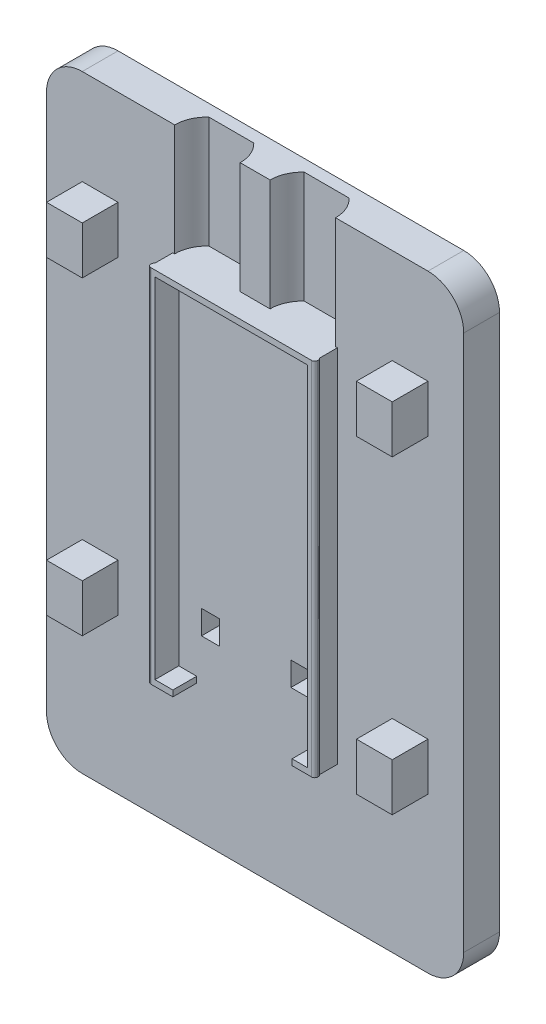
from build123d import *

# Parameters (mm, degrees)
SKETCH1_W            = 15
SKETCH1_H            = 36
BOSS_EXTRUDE1_DEPTH  = 2
SKETCH2_W            = 13.8
SKETCH2_H            = 33.26
SKETCH2_W_2          = 12.8
SKETCH2_H_2          = 32.26
BOSS_EXTRUDE2_DEPTH  = 2
SKETCH3_W            = 0.5
SKETCH3_H            = 33.26
BOSS_EXTRUDE3_DEPTH  = 0.1
FILLET1_R            = 0.25
SKETCH4_W            = 0.5
SKETCH4_H            = 33.26
BOSS_EXTRUDE4_DEPTH  = 0.1
FILLET2_R            = 0.25
CUT_EXTRUDE1_DEPTH   = 3
BOSS_EXTRUDE5_REACH  = 40.797
SKETCH6_W            = 2
SKETCH6_H            = 0.5
SKETCH7_W            = 6
SKETCH7_H            = 0.5
CUT_EXTRUDE2_DEPTH   = 0.5
SKETCH8_W            = 6
SKETCH8_H            = 0.5
CUT_EXTRUDE3_DEPTH   = 1
CUT_EXTRUDE5_DEPTH   = 4.37
SKETCH12_W           = 15
SKETCH12_H           = 36
BOSS_EXTRUDE7_DEPTH  = 1
SKETCH13_W           = 1.5
SKETCH13_H           = 2
CUT_EXTRUDE6_DEPTH   = 40.319206503
SKETCH14_W           = 3
SKETCH14_H           = 36
BOSS_EXTRUDE8_DEPTH  = 10
SKETCH15_W           = 3
SKETCH15_H           = 36
BOSS_EXTRUDE9_DEPTH  = 10
SKETCH17_W           = 2
SKETCH17_H           = 2
CUT_EXTRUDE7_DEPTH   = 10
SKETCH19_W           = 0.569871795
SKETCH19_H           = 3.175
CUT_EXTRUDE8_DEPTH   = 2
SKETCH20_W           = 0.569871794
SKETCH20_H           = 3.175
CUT_EXTRUDE9_DEPTH   = 2
SKETCH21_W           = 0.569871795
SKETCH21_H           = 3.175
CUT_EXTRUDE10_DEPTH  = 2
SKETCH22_W           = 3
SKETCH22_H           = 4
BOSS_EXTRUDE10_DEPTH = 3
BOSS_EXTRUDE11_START = 5
BOSS_EXTRUDE11_DEPTH = 5
FILLET3_R            = 3
SKETCH24_W           = 35
SKETCH24_H           = 3
BOSS_EXTRUDE12_DEPTH = 10
FILLET4_R            = 3


with BuildPart() as part:
    # Sketch1 → Boss-Extrude1 (new body)
    with BuildSketch(Plane.XY):
        with Locations((-7.5, 18)):
            Rectangle(SKETCH1_W, SKETCH1_H)
    extrude(amount=BOSS_EXTRUDE1_DEPTH)

    # Sketch2 → Boss-Extrude2 (add)
    with BuildSketch(Plane.XY.offset(2)):
        with Locations((-7.5, 18)):
            Rectangle(SKETCH2_W, SKETCH2_H)
        with Locations((-7.5, 18)):
            Rectangle(SKETCH2_W_2, SKETCH2_H_2, mode=Mode.SUBTRACT)
    extrude(amount=BOSS_EXTRUDE2_DEPTH)

    # Sketch3 → Boss-Extrude3 (add)
    with BuildSketch(Plane.ZY.offset(14.4)):
        with Locations((3.75, 18)):
            Rectangle(SKETCH3_W, SKETCH3_H)
    extrude(amount=BOSS_EXTRUDE3_DEPTH)

    # Fillet1
    # the kernel refuses this fillet: 0.25 mm, written as the material it takes off along each edge
    with BuildSketch(Plane(origin=(-14.5, 35.255, 4), x_dir=(1, 0, 0), z_dir=(0, -1, 0))) as fillet1_piece_1:
        with BuildLine():
            CenterArc((FILLET1_R, -FILLET1_R), FILLET1_R, 90, 90)
            Line((0, -FILLET1_R), (-FILLET1_R * 0.02, -FILLET1_R))
            Line((-FILLET1_R * 0.02, -FILLET1_R), (-FILLET1_R * 0.02, FILLET1_R * 0.02))
            Line((-FILLET1_R * 0.02, FILLET1_R * 0.02), (FILLET1_R, FILLET1_R * 0.02))
            Line((FILLET1_R, FILLET1_R * 0.02), (FILLET1_R, 0))
        make_face()
    extrude(amount=34.51, mode=Mode.SUBTRACT)
    with BuildSketch(Plane(origin=(-14.5, 0.87, 3.5), x_dir=(0, 0, 1), z_dir=(0, 1, 0))) as fillet1_piece_2:
        with BuildLine():
            CenterArc((0.2, 0.25), FILLET1_R, 216.869897645, 53.130102355)
            Line((0, 0.1), (-0.004, 0.097))
            ThreePointArc((-0.004, 0.097), (-0.005, 0.05), (-0.005, 0))
            Line((-0.005, 0), (0, -0.005))
            Line((0, -0.005), (0.2, -0.005))
            Line((0.2, -0.005), (0.2, 0))
        make_face()
    extrude(amount=34.26, mode=Mode.SUBTRACT)

    # Sketch4 → Boss-Extrude4 (add)
    with BuildSketch(Plane(origin=(-0.6, 0, 0), x_dir=(0, 0, -1), z_dir=(1, 0, 0))):
        with Locations((-3.75, 18)):
            Rectangle(SKETCH4_W, SKETCH4_H)
    extrude(amount=BOSS_EXTRUDE4_DEPTH)

    # Fillet2
    # the kernel refuses this fillet: 0.25 mm, written as the material it takes off along each edge
    with BuildSketch(Plane(origin=(-0.5, 35.255, 4), x_dir=(0, 0, -1), z_dir=(0, -1, 0))) as fillet2_piece_1:
        with BuildLine():
            CenterArc((FILLET2_R, -FILLET2_R), FILLET2_R, 90, 90)
            Line((0, -FILLET2_R), (-FILLET2_R * 0.02, -FILLET2_R))
            Line((-FILLET2_R * 0.02, -FILLET2_R), (-FILLET2_R * 0.02, FILLET2_R * 0.02))
            Line((-FILLET2_R * 0.02, FILLET2_R * 0.02), (FILLET2_R, FILLET2_R * 0.02))
            Line((FILLET2_R, FILLET2_R * 0.02), (FILLET2_R, 0))
        make_face()
    extrude(amount=34.51, mode=Mode.SUBTRACT)
    with BuildSketch(Plane(origin=(-0.5, 0.87, 3.5), x_dir=(-1.0, 0, 2.6085800186082363e-11), z_dir=(0, 1, 0))) as fillet2_piece_2:
        with BuildLine():
            CenterArc((0.25, 0.2), FILLET2_R, 179.999999999, 53.130102355)
            Line((0, 0.2), (-0.005, 0.2))
            Line((-0.005, 0.2), (-0.005, 0))
            Line((-0.005, 0), (0, -0.005))
            ThreePointArc((0, -0.005), (0.05, -0.005), (0.097, -0.004))
            Line((0.097, -0.004), (0.1, 0))
        make_face()
    extrude(amount=34.26, mode=Mode.SUBTRACT)

    # Sketch5 → Cut-Extrude1 (cut)
    with BuildSketch(Plane(origin=(0, 34.63, 0), x_dir=(1, 0, 0), z_dir=(0, 1, 0))):
        with BuildLine():
            Line((-14.25, -4), (-0.75, -4))
            ThreePointArc((-0.75, -4), (-0.573223305, -3.926776695), (-0.5, -3.75))
            Line((-0.5, -3.75), (-0.5, -3.7))
            ThreePointArc((-0.5, -3.7), (-0.526393202, -3.588196601), (-0.6, -3.5))
            Line((-0.6, -3.5), (-0.6, -2))
            Line((-0.6, -2), (-14.4, -2))
            Line((-14.4, -2), (-14.4, -3.5))
            ThreePointArc((-14.4, -3.5), (-14.473606798, -3.588196601), (-14.5, -3.7))
            Line((-14.5, -3.7), (-14.5, -3.75))
            ThreePointArc((-14.5, -3.75), (-14.426776695, -3.926776695), (-14.25, -4))
        make_face()
    extrude(amount=-CUT_EXTRUDE1_DEPTH, mode=Mode.SUBTRACT)

    # Sketch6 → Boss-Extrude5 (add, up to next)
    with BuildSketch(Plane.ZY.offset(1.1), mode=Mode.PRIVATE) as boss_extrude5_sk1:
        with Locations((3, 31.38)):
            Rectangle(SKETCH6_W, SKETCH6_H)
    boss_extrude5_tool1 = extrude(boss_extrude5_sk1.sketch, amount=BOSS_EXTRUDE5_REACH, mode=Mode.PRIVATE) - part.part
    add(boss_extrude5_tool1.solids().sort_by_distance((-1.1, 31.38, 3))[0])

    # Sketch7 → Cut-Extrude2 (cut)
    with BuildSketch(Plane.XZ.offset(-1.37)):
        with Locations((-7.4, 3.75)):
            Rectangle(SKETCH7_W, SKETCH7_H)
        with Locations((-7.4, 3.25)):
            Rectangle(SKETCH7_W, SKETCH7_H)
    extrude(amount=-CUT_EXTRUDE2_DEPTH, mode=Mode.SUBTRACT)

    # Sketch8 → Cut-Extrude3 (cut)
    with BuildSketch(Plane.XY.offset(3)):
        with Locations((-7.4, 1.62)):
            Rectangle(SKETCH8_W, SKETCH8_H)
    extrude(amount=-CUT_EXTRUDE3_DEPTH, mode=Mode.SUBTRACT)

    # Sketch10 → Cut-Extrude5 (cut)
    with BuildSketch(Plane(origin=(0, 36, 0), x_dir=(1, 0, 0), z_dir=(0, 1, 0))):
        with BuildLine():
            ThreePointArc((-8.75, -2), (-8.974825632, -0.910966294), (-9.612541391, 0))
            Line((-9.612541391, 0), (-13.387458609, 0))
            ThreePointArc((-13.387458609, 0), (-14.025174368, -0.910966294), (-14.25, -2))
            Line((-14.25, -2), (-8.75, -2))
        make_face()
        with BuildLine():
            ThreePointArc((-14.25, -2), (-11.5, -4.75), (-8.75, -2))
            Line((-8.75, -2), (-14.25, -2))
        make_face()
        with BuildLine():
            ThreePointArc((-0.75, -2), (-0.974825632, -0.910966294), (-1.612541391, 0))
            Line((-1.612541391, 0), (-5.387458609, 0))
            ThreePointArc((-5.387458609, 0), (-6.025174368, -0.910966294), (-6.25, -2))
            Line((-6.25, -2), (-0.75, -2))
        make_face()
        with BuildLine():
            ThreePointArc((-6.25, -2), (-3.5, -4.75), (-0.75, -2))
            Line((-0.75, -2), (-6.25, -2))
        make_face()
    extrude(amount=-CUT_EXTRUDE5_DEPTH, mode=Mode.SUBTRACT)

    # Sketch12 → Boss-Extrude7 (add)
    with BuildSketch(Plane(origin=(0, 0, 0), x_dir=(-1, 0, 0), z_dir=(0, 0, -1))):
        with Locations((7.5, 18)):
            Rectangle(SKETCH12_W, SKETCH12_H)
    extrude(amount=BOSS_EXTRUDE7_DEPTH)

    # Sketch13 → Cut-Extrude6 (cut, through all)
    with BuildSketch(Plane(origin=(0, 0, -1), x_dir=(-1, 0, 0), z_dir=(0, 0, -1))):
        with Locations((3.75, 6)):
            Rectangle(SKETCH13_W, SKETCH13_H)
        with Locations((11.25, 6)):
            Rectangle(SKETCH13_W, SKETCH13_H)
    extrude(amount=-CUT_EXTRUDE6_DEPTH, mode=Mode.SUBTRACT)

    # Sketch14 → Boss-Extrude8 (add)
    with BuildSketch(Plane.ZY.offset(15)):
        with Locations((0.5, 18)):
            Rectangle(SKETCH14_W, SKETCH14_H)
    extrude(amount=BOSS_EXTRUDE8_DEPTH)

    # Sketch15 → Boss-Extrude9 (add)
    with BuildSketch(Plane(origin=(0, 0, 0), x_dir=(0, 0, -1), z_dir=(1, 0, 0))):
        with Locations((-0.5, 18)):
            Rectangle(SKETCH15_W, SKETCH15_H)
    extrude(amount=BOSS_EXTRUDE9_DEPTH)

    # Sketch17 → Cut-Extrude7 (cut)
    with BuildSketch(Plane.XZ.offset(-1.37)):
        with Locations((-3.4, 3)):
            Rectangle(SKETCH17_W, SKETCH17_H)
        with Locations((-11.4, 3)):
            Rectangle(SKETCH17_W, SKETCH17_H)
    extrude(amount=-CUT_EXTRUDE7_DEPTH, mode=Mode.SUBTRACT)

    # Sketch19 → Cut-Extrude8 (cut)
    # profile 1 of 11: a face of its own
    with BuildSketch(Plane(origin=(0, 0, -1), x_dir=(-1, 0, 0), z_dir=(0, 0, -1))):
        Polygon((22.350375601, 14.825), (21.760151242, 14.825), (21.034455128, 17.039613381), (20.304942909, 14.825), (19.719170673, 14.825), (19.182371795, 18), (19.759239784, 18), (20.098237179, 15.994636418), (20.758423478, 18), (21.313666867, 18), (21.970673077, 15.994636418), (22.309034455, 18), (22.886538462, 18), align=None)
    # profile 2 of 11: a face of its own
    with BuildSketch(Plane(origin=(0, 0, -1), x_dir=(-1, 0, 0), z_dir=(0, 0, -1))):
        Polygon((18.653205128, 14.825), (16.943589744, 14.825), (16.943589744, 15.394871795), (18.083333333, 15.394871795), (18.083333333, 16.005448718), (16.943589744, 16.005448718), (16.943589744, 16.575320513), (18.083333333, 16.575320513), (18.083333333, 17.430128205), (16.943589744, 17.430128205), (16.943589744, 18), (18.653205128, 18), align=None)
    # profile 3 of 11: a face of its own
    with BuildSketch(Plane(origin=(0, 0, -1), x_dir=(-1, 0, 0), z_dir=(0, 0, -1))):
        Polygon((16.373717949, 14.825), (15.803846154, 14.825), (15.803846154, 15.942482973), (14.903245192, 14.825), (14.183909255, 14.825), (15.315384615, 16.229326923), (14.073878205, 18), (14.760141226, 18), (15.803846154, 16.511082732), (15.803846154, 18), (16.373717949, 18), align=None)
    # profile 4 of 11: a face of its own
    with BuildSketch(Plane(origin=(0, 0, -1), x_dir=(-1, 0, 0), z_dir=(0, 0, -1))):
        Polygon((12.6701873, 14.825), (12.140384615, 14.825), (10.858173077, 18), (11.466841947, 18), (11.713616787, 17.348717949), (13.095683093, 17.348717949), (13.34309395, 18), (13.951762821, 18), align=None)
        Polygon((12.404967949, 15.676627604), (12.879437099, 16.778846154), (11.92986278, 16.778846154), align=None, mode=Mode.SUBTRACT)
    # profile 5 of 11: a face of its own
    with BuildSketch(Plane(origin=(0, 0, -1), x_dir=(-1, 0, 0), z_dir=(0, 0, -1))):
        Polygon((10.715705128, 14.825), (9.006089744, 14.825), (9.006089744, 15.394871795), (9.575961538, 15.394871795), (9.575961538, 18), (10.145833333, 18), (10.145833333, 15.394871795), (10.715705128, 15.394871795), align=None)
    # profile 6 of 11: a face of its own
    with BuildSketch(Plane(origin=(0, 0, -1), x_dir=(-1, 0, 0), z_dir=(0, 0, -1))):
        with BuildLine():
            Line((8.558333333, 14.825), (7.894330929, 14.825))
            add(Edge.make_bspline(
                [(7.894330929, 14.825), (7.850440182, 14.825153029), (7.766025912, 14.825447346), (7.644311396, 14.830211041), (7.532477774, 14.836666802), (7.430276587, 14.847123937), (7.337824312, 14.859140055), (7.255309483, 14.875270887), (7.182425217, 14.893165349), (7.118274948, 14.915185417), (7.060523323, 14.940503592), (7.006902172, 14.969165211), (6.956071767, 15.001950258), (6.908402238, 15.038753478), (6.862426654, 15.078177154), (6.820606504, 15.122512574), (6.781076173, 15.170308639), (6.744250858, 15.221568442), (6.711186997, 15.276172328), (6.682676053, 15.33346752), (6.658127273, 15.393106468), (6.638699383, 15.45530709), (6.623205528, 15.51989231), (6.612844649, 15.586701886), (6.605146542, 15.655885186), (6.60470991, 15.702893532), (6.604487179, 15.726872997)],
                knots=[0, 0, 0, 0, 1.748592178, 3.36303531, 4.852592433, 6.210838904, 7.455605234, 8.565530618, 9.559147328, 10.443333557, 11.264119507, 12.069061813, 12.863340979, 13.67089394, 14.467102114, 15.273638367, 16.095597024, 16.937114566, 17.786018611, 18.63597263, 19.484582448, 20.352808207, 21.22970172, 22.128176732, 23.04516274, 24, 24, 24, 24], degree=3))
            add(Edge.make_bspline(
                [(6.604487179, 15.726872997), (6.605073427, 15.751900745), (6.60622295, 15.800975598), (6.612363576, 15.873072027), (6.623779721, 15.942216089), (6.640507661, 16.007964058), (6.660530023, 16.070989309), (6.686460912, 16.130308178), (6.715948324, 16.186970008), (6.750929958, 16.240041067), (6.789344771, 16.290661866), (6.833959023, 16.336993878), (6.88225183, 16.381233427), (6.935692775, 16.421874001), (6.994121859, 16.458662607), (7.056440383, 16.493093543), (7.123509588, 16.524555258), (7.170620382, 16.542152897), (7.194711538, 16.551151843)],
                knots=[0, 0, 0, 0, 1.099808295, 2.156523617, 3.176426857, 4.17500812, 5.135317955, 6.078349783, 7.015890908, 7.9382699, 8.868004242, 9.803692517, 10.759882289, 11.743580734, 12.748787378, 13.791075452, 14.870417076, 16, 16, 16, 16], degree=3))
            Line((7.194711538, 16.551151843), (6.462019231, 18))
            Line((6.462019231, 18), (7.095492788, 18))
            Line((7.095492788, 18), (7.795112179, 16.616025641))
            Line((7.795112179, 16.616025641), (7.988461538, 16.616025641))
            Line((7.988461538, 16.616025641), (7.988461538, 18))
            Line((7.988461538, 18), (8.558333333, 18))
            Line((8.558333333, 18), (8.558333333, 14.825))
        make_face()
        with BuildLine():
            Line((7.988461538, 16.046153846), (7.766491386, 16.046153846))
            add(Edge.make_bspline(
                [(7.766491386, 16.046153846), (7.739353686, 16.045848208), (7.68739082, 16.045262976), (7.612661464, 16.042548329), (7.544789145, 16.036007705), (7.483483442, 16.027743006), (7.428432513, 16.018202923), (7.380138092, 16.004522214), (7.337822066, 15.989889692), (7.302092007, 15.971618104), (7.27144049, 15.95120474), (7.245748257, 15.926991472), (7.223114325, 15.900467122), (7.205360072, 15.869962233), (7.19101578, 15.836726585), (7.182119913, 15.800134881), (7.175061886, 15.760849658), (7.174599559, 15.73348222), (7.174358974, 15.719240785)],
                knots=[0, 0, 0, 0, 1.688935225, 3.233948049, 4.651771667, 5.929878493, 7.083962697, 8.124219224, 9.050753627, 9.864999381, 10.615157594, 11.334035464, 12.05533055, 12.777108108, 13.522027315, 14.29964284, 15.115170198, 16, 16, 16, 16], degree=3))
            add(Edge.make_bspline(
                [(7.174358974, 15.719240785), (7.174973733, 15.702404648), (7.1761738, 15.669538916), (7.189149909, 15.622091077), (7.208729229, 15.577855424), (7.236447656, 15.537444695), (7.27102761, 15.502087716), (7.310655133, 15.471107287), (7.356090081, 15.446311213), (7.398042788, 15.429399477), (7.436840142, 15.419651628), (7.471620414, 15.412678999), (7.511971976, 15.407030415), (7.557837441, 15.402873307), (7.609132523, 15.398917737), (7.665978951, 15.396468814), (7.728325929, 15.395376049), (7.771791197, 15.395044719), (7.794476162, 15.394871795)],
                knots=[0, 0, 0, 0, 1.020050218, 1.991234449, 2.965145773, 3.94719294, 4.948794399, 5.958308566, 6.989992871, 8.082620171, 8.694688219, 9.416833949, 10.236190632, 11.167557654, 12.21328564, 13.36031274, 14.622320386, 16, 16, 16, 16], degree=3))
            Line((7.794476162, 15.394871795), (7.988461538, 15.394871795))
            Line((7.988461538, 15.394871795), (7.988461538, 16.046153846))
        make_face(mode=Mode.SUBTRACT)
    # profile 7 of 11: a face of its own
    with BuildSketch(Plane(origin=(0, 0, -1), x_dir=(-1, 0, 0), z_dir=(0, 0, -1))):
        with BuildLine():
            add(Edge.make_bspline(
                [(4.501812901, 14.743589744), (4.446611359, 14.745018429), (4.337631013, 14.747838978), (4.177365021, 14.771368179), (4.022900583, 14.809661515), (3.874215556, 14.863112846), (3.73181703, 14.932337113), (3.595181796, 15.016388834), (3.464684288, 15.115981224), (3.341845977, 15.229693094), (3.229206253, 15.354033467), (3.130194656, 15.486598216), (3.04614636, 15.626018668), (2.977924155, 15.772321987), (2.924647533, 15.925307209), (2.887620908, 16.085032394), (2.863747018, 16.251293004), (2.861007625, 16.36450339), (2.859615385, 16.422040264)],
                knots=[0, 0, 0, 0, 1.014151002, 2.002163778, 2.969868608, 3.93493411, 4.9003771, 5.874719092, 6.87846472, 7.912488755, 8.947011879, 9.957751389, 10.948740761, 11.933621513, 12.919426746, 13.920294397, 14.943031967, 16, 16, 16, 16], degree=3))
            add(Edge.make_bspline(
                [(2.859615385, 16.422040264), (2.861098529, 16.478928721), (2.864021112, 16.591029251), (2.886643384, 16.755759264), (2.924313544, 16.913767726), (2.976563056, 17.065108655), (3.043592381, 17.209784531), (3.126357097, 17.347325898), (3.224313436, 17.478015362), (3.335460428, 17.601052269), (3.45706872, 17.713459614), (3.586640156, 17.812139455), (3.722970951, 17.895138311), (3.865190067, 17.964029142), (4.014639179, 18.015798641), (4.169661356, 18.054548265), (4.331553403, 18.076955431), (4.44153581, 18.079910381), (4.497360777, 18.081410256)],
                knots=[0, 0, 0, 0, 1.051517626, 2.07204922, 3.067438659, 4.05042616, 5.027204762, 6.009981242, 7.012629434, 8.042243656, 9.071350414, 10.070091277, 11.048190212, 12.017682766, 12.985867053, 13.966945899, 14.968060614, 16, 16, 16, 16], degree=3))
            add(Edge.make_bspline(
                [(4.497360777, 18.081410256), (4.555751518, 18.080080567), (4.670481342, 18.077467909), (4.838430632, 18.052832314), (4.999111233, 18.015272069), (5.152082876, 17.960893871), (5.297226642, 17.890236974), (5.435193441, 17.804924162), (5.564945639, 17.703307502), (5.686050733, 17.588451925), (5.795759462, 17.46274214), (5.892602274, 17.329949358), (5.974290496, 17.191077812), (6.040828324, 17.046065161), (6.093284019, 16.895811929), (6.130285566, 16.739403216), (6.152143259, 16.577214096), (6.155187909, 16.467052006), (6.156730769, 16.411227965)],
                knots=[0, 0, 0, 0, 1.067953136, 2.098381936, 3.099641766, 4.083805132, 5.062469929, 6.048665414, 7.046702845, 8.073106546, 9.098695993, 10.09591865, 11.076726721, 12.041940862, 13.011263376, 13.984305721, 14.978557872, 16, 16, 16, 16], degree=3))
            add(Edge.make_bspline(
                [(6.156730769, 16.411227965), (6.15623985, 16.373674101), (6.155264228, 16.29904189), (6.143769875, 16.188412056), (6.126722345, 16.080100136), (6.103384685, 15.973902451), (6.071941098, 15.870092681), (6.033723971, 15.768408971), (5.989188972, 15.668851883), (5.937832375, 15.57232177), (5.879737817, 15.479973563), (5.817708503, 15.391000688), (5.749368581, 15.307738858), (5.676128615, 15.229283644), (5.597701732, 15.155993684), (5.513951342, 15.087618724), (5.425009266, 15.024333159), (5.331837533, 14.96561403), (5.23475486, 14.914185197), (5.136071028, 14.867568725), (5.034838682, 14.829772102), (4.931792839, 14.798467749), (4.827170409, 14.773344734), (4.720163617, 14.756640071), (4.611675575, 14.745054912), (4.538520701, 14.744079292), (4.501812901, 14.743589744)],
                knots=[0, 0, 0, 0, 1.034641744, 2.056182551, 3.061960284, 4.05571729, 5.050247014, 6.048716841, 7.047801973, 8.054190544, 9.059424999, 10.053182006, 11.041513076, 12.025412457, 13.009311837, 13.997642908, 15.002928308, 16.016213968, 17.030509951, 18.02913364, 19.022134519, 20.005478534, 20.996155877, 21.984625117, 22.988721131, 24, 24, 24, 24], degree=3))
        make_face()
        with BuildLine():
            add(Edge.make_bspline(
                [(4.510717147, 15.313461538), (4.54786759, 15.31445837), (4.621187699, 15.316425715), (4.728734976, 15.331414192), (4.831984041, 15.355352586), (4.9303631, 15.390026725), (5.024296485, 15.434159293), (5.11395838, 15.487590744), (5.198078079, 15.552178152), (5.277889382, 15.624376789), (5.349742622, 15.705154977), (5.414348418, 15.790779403), (5.466584827, 15.883310334), (5.511500681, 15.979700051), (5.544677986, 16.08238615), (5.569939044, 16.189702041), (5.583697885, 16.302749401), (5.585790266, 16.37960518), (5.586858974, 16.418860176)],
                knots=[0, 0, 0, 0, 1.033668485, 2.040047952, 3.016132939, 3.979056467, 4.937231767, 5.900589077, 6.877725736, 7.88429546, 8.891280164, 9.882584218, 10.863295226, 11.842887319, 12.837417301, 13.860812229, 14.907384602, 16, 16, 16, 16], degree=3))
            add(Edge.make_bspline(
                [(5.586858974, 16.418860176), (5.585559907, 16.462375657), (5.583013951, 16.547658789), (5.5653609, 16.672134216), (5.534429313, 16.789553654), (5.49217304, 16.900309912), (5.436002398, 17.003238323), (5.368821042, 17.099586722), (5.288946899, 17.188757317), (5.227520642, 17.240862201), (5.196344151, 17.267307692)],
                knots=[0, 0, 0, 0, 1.078343132, 2.113373867, 3.107373148, 4.082093053, 5.043582658, 6.005574554, 6.987742499, 8, 8, 8, 8], degree=3))
            add(Edge.make_bspline(
                [(5.196344151, 17.267307692), (5.170797848, 17.286841507), (5.120280805, 17.325469037), (5.039644606, 17.374978141), (4.9566052, 17.417412382), (4.870535949, 17.451698747), (4.781618627, 17.478667825), (4.689865428, 17.497553827), (4.595406359, 17.509406426), (4.531528709, 17.510823036), (4.49926883, 17.511538462)],
                knots=[0, 0, 0, 0, 1.023928204, 2.024787132, 3.009472467, 3.9914905, 4.972207045, 5.96565515, 6.972602802, 8, 8, 8, 8], degree=3))
            add(Edge.make_bspline(
                [(4.49926883, 17.511538462), (4.462757897, 17.510531752), (4.390921486, 17.50855102), (4.285366169, 17.493767427), (4.184287876, 17.468638761), (4.086749717, 17.434514944), (3.994057803, 17.388783118), (3.904766672, 17.334480081), (3.819940522, 17.26991224), (3.740613436, 17.195894137), (3.667914402, 17.115112139), (3.603595989, 17.029024579), (3.55032974, 16.937628109), (3.505898909, 16.842143586), (3.471282343, 16.741810755), (3.447592325, 16.636622047), (3.432367204, 16.527001851), (3.430459192, 16.452408645), (3.429487179, 16.414408053)],
                knots=[0, 0, 0, 0, 1.026350473, 2.019376834, 2.989435443, 3.95094063, 4.91865229, 5.889827372, 6.885283771, 7.910196595, 8.935871797, 9.9372888, 10.925850568, 11.904605667, 12.894245083, 13.903507864, 14.931967858, 16, 16, 16, 16], degree=3))
            add(Edge.make_bspline(
                [(3.429487179, 16.414408053), (3.430489059, 16.376624416), (3.432461105, 16.302253089), (3.447327545, 16.192936993), (3.472042495, 16.088326262), (3.506972618, 15.988151237), (3.550488283, 15.891886006), (3.605151203, 15.800366069), (3.669776532, 15.713670607), (3.743182864, 15.632315034), (3.823068002, 15.557549463), (3.908836144, 15.492667815), (3.998083299, 15.436287394), (4.092858304, 15.392121329), (4.191221865, 15.356934297), (4.293774275, 15.331022067), (4.400903938, 15.316531006), (4.473786464, 15.314493815), (4.510717147, 15.313461538)],
                knots=[0, 0, 0, 0, 1.055040155, 2.076685641, 3.074845078, 4.052329834, 5.035358467, 6.020382375, 7.023447318, 8.050688466, 9.077178457, 10.074336316, 11.0503314, 12.019748348, 12.988025369, 13.964577102, 14.968620271, 16, 16, 16, 16], degree=3))
        make_face(mode=Mode.SUBTRACT)
    # profile 8 of 11: a face of its own
    with BuildSketch(Plane(origin=(0, 0, -1), x_dir=(-1, 0, 0), z_dir=(0, 0, -1))):
        Polygon((2.28974359, 14.825), (1.776477364, 14.825), (0.335897436, 16.914317909), (0.335897436, 14.825), (-0.233974359, 14.825), (-0.233974359, 18), (0.283107973, 18), (1.719871795, 15.917042268), (1.719871795, 18), (2.28974359, 18), align=None)
    # profile 9 of 11: a face of its own
    with BuildSketch(Plane(origin=(0, 0, -1), x_dir=(-1, 0, 0), z_dir=(0, 0, -1))):
        with Locations((-1.170192308, 16.4125)):
            Rectangle(SKETCH19_W, SKETCH19_H)
    # profile 10 of 11: a face of its own
    with BuildSketch(Plane(origin=(0, 0, -1), x_dir=(-1, 0, 0), z_dir=(0, 0, -1))):
        Polygon((-2.187820513, 14.825), (-2.757692308, 14.825), (-2.757692308, 15.942482973), (-3.658293269, 14.825), (-4.377629207, 14.825), (-3.246153846, 16.229326923), (-4.487660256, 18), (-3.801397236, 18), (-2.757692308, 16.511082732), (-2.757692308, 18), (-2.187820513, 18), align=None)
    # profile 11 of 11: a face of its own
    with BuildSketch(Plane(origin=(0, 0, -1), x_dir=(-1, 0, 0), z_dir=(0, 0, -1))):
        Polygon((-5.891351162, 14.825), (-6.421153846, 14.825), (-7.703365385, 18), (-7.094696514, 18), (-6.847921675, 17.348717949), (-5.465855369, 17.348717949), (-5.218444511, 18), (-4.609775641, 18), align=None)
        Polygon((-6.156570513, 15.676627604), (-5.682101362, 16.778846154), (-6.631675681, 16.778846154), align=None, mode=Mode.SUBTRACT)
    extrude(amount=-CUT_EXTRUDE8_DEPTH, mode=Mode.SUBTRACT)

    # Sketch20 → Cut-Extrude9 (cut)
    # profile 1 of 10: a face of its own
    with BuildSketch(Plane(origin=(0, 0, -1), x_dir=(-1, 0, 0), z_dir=(0, 0, -1))):
        with BuildLine():
            Line((18.775320513, 19.546245865), (18.139302885, 19.546245865))
            add(Edge.make_bspline(
                [(18.139302885, 19.546245865), (18.097746318, 19.546431881), (18.017574989, 19.546790744), (17.901961342, 19.551142451), (17.795302076, 19.558940953), (17.697621762, 19.568578732), (17.608960354, 19.582090305), (17.529207498, 19.597580934), (17.458344467, 19.616450849), (17.395579176, 19.63885612), (17.339231981, 19.665247953), (17.285972015, 19.693437354), (17.236600874, 19.726851524), (17.189959467, 19.763081904), (17.146400611, 19.802882237), (17.105601527, 19.846095221), (17.067982333, 19.893348868), (17.033778876, 19.944317642), (17.002734023, 19.997963855), (16.975615676, 20.054409843), (16.953617639, 20.113737738), (16.935164345, 20.175565698), (16.920342394, 20.239890495), (16.910476452, 20.30710788), (16.903775002, 20.376748475), (16.903183692, 20.42414591), (16.902884615, 20.448118862)],
                knots=[0, 0, 0, 0, 1.698787518, 3.27731721, 4.728409951, 6.070286353, 7.288646904, 8.393455548, 9.389990496, 10.283725379, 11.113616976, 11.931887102, 12.744353494, 13.547053751, 14.344590688, 15.153907614, 15.974148981, 16.810666655, 17.660988447, 18.506082349, 19.367288142, 20.244738011, 21.142497992, 22.06302001, 23.020302899, 24, 24, 24, 24], degree=3))
            add(Edge.make_bspline(
                [(16.902884615, 20.448118862), (16.903315466, 20.474640337), (16.904162139, 20.526758293), (16.912524978, 20.603143728), (16.926670257, 20.676019894), (16.945606825, 20.745698118), (16.970306939, 20.812025965), (17.00126445, 20.874567714), (17.0366756, 20.934107059), (17.078479873, 20.98955502), (17.124673726, 21.041193851), (17.174413948, 21.089585513), (17.229193016, 21.132741019), (17.287055696, 21.17290397), (17.349657602, 21.207716967), (17.415143959, 21.23995235), (17.485175688, 21.267307026), (17.53391046, 21.281658187), (17.55861879, 21.288934166)],
                knots=[0, 0, 0, 0, 1.101767505, 2.165108537, 3.187936629, 4.183892551, 5.162396277, 6.123736501, 7.080098904, 8.036826416, 9.0040019, 9.957275584, 10.916231297, 11.898534744, 12.880877694, 13.889532316, 14.930001539, 16, 16, 16, 16], degree=3))
            add(Edge.make_bspline(
                [(17.55861879, 21.288934166), (17.574894948, 21.292983701), (17.610154346, 21.301756296), (17.668498966, 21.310662682), (17.735735015, 21.318851557), (17.81207991, 21.325888903), (17.897577667, 21.330672659), (17.992145501, 21.334408559), (18.095826269, 21.337124945), (18.167921775, 21.337221334), (18.205448718, 21.337271506)],
                knots=[0, 0, 0, 0, 0.618981996, 1.340914327, 2.176866532, 3.120127938, 4.170906482, 5.338178032, 6.614476169, 8, 8, 8, 8], degree=3))
            Line((18.205448718, 21.337271506), (18.205448718, 22.721245865))
            Line((18.205448718, 22.721245865), (18.775320513, 22.721245865))
            Line((18.775320513, 22.721245865), (18.775320513, 19.546245865))
        make_face()
        with BuildLine():
            Line((18.205448718, 20.767399711), (18.00383113, 20.767399711))
            add(Edge.make_bspline(
                [(18.00383113, 20.767399711), (17.967143027, 20.76716795), (17.899636373, 20.766741506), (17.80745445, 20.760541982), (17.733350988, 20.751116273), (17.674872163, 20.73748728), (17.628679778, 20.717193673), (17.589319083, 20.692717479), (17.554349564, 20.663304895), (17.525199723, 20.628043788), (17.50144542, 20.588703616), (17.48478443, 20.544987325), (17.474268728, 20.497593548), (17.473270012, 20.46450107), (17.47275641, 20.447482844)],
                knots=[0, 0, 0, 0, 1.862351722, 3.426754836, 4.68713255, 5.653025869, 6.462861518, 7.236406327, 7.999926698, 8.771672214, 9.54880311, 10.322347919, 11.137246204, 12, 12, 12, 12], degree=3))
            add(Edge.make_bspline(
                [(17.47275641, 20.447482844), (17.473253996, 20.432610525), (17.474219433, 20.403754648), (17.481409536, 20.362137753), (17.492568943, 20.323418311), (17.509623931, 20.288136061), (17.530330241, 20.255468075), (17.556598771, 20.226431317), (17.586891785, 20.200086349), (17.61031862, 20.186159102), (17.622220553, 20.179083405)],
                knots=[0, 0, 0, 0, 1.102449765, 2.139017612, 3.12397484, 4.080535277, 5.035673127, 5.982361139, 6.974944601, 8, 8, 8, 8], degree=3))
            add(Edge.make_bspline(
                [(17.622220553, 20.179083405), (17.63229963, 20.173986127), (17.653639101, 20.163194144), (17.68998229, 20.150647676), (17.731921774, 20.140063347), (17.779740694, 20.131278457), (17.833248285, 20.124460469), (17.892435, 20.119246415), (17.95738794, 20.11714964), (18.002558823, 20.116471141), (18.026091747, 20.11611766)],
                knots=[0, 0, 0, 0, 0.656809284, 1.390599849, 2.23162475, 3.173112763, 4.218524733, 5.370385145, 6.63003504, 8, 8, 8, 8], degree=3))
            Line((18.026091747, 20.11611766), (18.205448718, 20.11611766))
            Line((18.205448718, 20.11611766), (18.205448718, 20.767399711))
        make_face(mode=Mode.SUBTRACT)
    # profile 2 of 10: a face of its own
    with BuildSketch(Plane(origin=(0, 0, -1), x_dir=(-1, 0, 0), z_dir=(0, 0, -1))):
        with BuildLine():
            add(Edge.make_bspline(
                [(14.840915465, 19.464835609), (14.785713923, 19.466264294), (14.676733577, 19.469084843), (14.516467586, 19.492614045), (14.362003147, 19.530907381), (14.213318121, 19.584358711), (14.070919594, 19.653582978), (13.93428436, 19.7376347), (13.803786852, 19.837227089), (13.680948541, 19.950938959), (13.568308817, 20.075279332), (13.46929722, 20.207844082), (13.385248924, 20.347264534), (13.317026719, 20.493567852), (13.263750098, 20.646553074), (13.226723472, 20.806278259), (13.202849582, 20.972538869), (13.200110189, 21.085749256), (13.198717949, 21.14328613)],
                knots=[0, 0, 0, 0, 1.014151002, 2.002163778, 2.969868608, 3.93493411, 4.9003771, 5.874719092, 6.87846472, 7.912488755, 8.947011879, 9.957751389, 10.948740761, 11.933621513, 12.919426746, 13.920294397, 14.943031967, 16, 16, 16, 16], degree=3))
            add(Edge.make_bspline(
                [(13.198717949, 21.14328613), (13.200201093, 21.200174587), (13.203123676, 21.312275116), (13.225745948, 21.47700513), (13.263416108, 21.635013591), (13.31566562, 21.78635452), (13.382694945, 21.931030396), (13.465459661, 22.068571763), (13.563416, 22.199261228), (13.674562992, 22.322298134), (13.796171284, 22.434705479), (13.92574272, 22.53338532), (14.062073516, 22.616384176), (14.204292631, 22.685275007), (14.353741743, 22.737044507), (14.50876392, 22.77579413), (14.670655967, 22.798201297), (14.780638375, 22.801156246), (14.836463341, 22.802656122)],
                knots=[0, 0, 0, 0, 1.051517626, 2.07204922, 3.067438659, 4.05042616, 5.027204762, 6.009981242, 7.012629434, 8.042243656, 9.071350414, 10.070091277, 11.048190212, 12.017682766, 12.985867053, 13.966945899, 14.968060614, 16, 16, 16, 16], degree=3))
            add(Edge.make_bspline(
                [(14.836463341, 22.802656122), (14.894854082, 22.801326432), (15.009583906, 22.798713774), (15.177533196, 22.774078179), (15.338213797, 22.736517934), (15.49118544, 22.682139736), (15.636329206, 22.611482839), (15.774296005, 22.526170027), (15.904048203, 22.424553368), (16.025153297, 22.309697791), (16.134862026, 22.183988006), (16.231704838, 22.051195224), (16.31339306, 21.912323678), (16.379930888, 21.767311026), (16.432386583, 21.617057794), (16.46938813, 21.460649081), (16.491245823, 21.298459961), (16.494290473, 21.188297871), (16.495833333, 21.13247383)],
                knots=[0, 0, 0, 0, 1.067953136, 2.098381936, 3.099641766, 4.083805132, 5.062469929, 6.048665414, 7.046702845, 8.073106546, 9.098695993, 10.09591865, 11.076726721, 12.041940862, 13.011263376, 13.984305721, 14.978557872, 16, 16, 16, 16], degree=3))
            add(Edge.make_bspline(
                [(16.495833333, 21.13247383), (16.495342414, 21.094919966), (16.494366792, 21.020287756), (16.482872439, 20.909657922), (16.465824909, 20.801346001), (16.442487249, 20.695148316), (16.411043662, 20.591338546), (16.372826535, 20.489654836), (16.328291536, 20.390097748), (16.276934939, 20.293567635), (16.218840381, 20.201219429), (16.156811067, 20.112246553), (16.088471145, 20.028984723), (16.015231179, 19.950529509), (15.936804296, 19.877239549), (15.853053906, 19.80886459), (15.76411183, 19.745579024), (15.670940097, 19.686859896), (15.573857424, 19.635431062), (15.475173592, 19.58881459), (15.373941246, 19.551017967), (15.270895403, 19.519713614), (15.166272974, 19.494590599), (15.059266181, 19.477885936), (14.950778139, 19.466300777), (14.877623265, 19.465325157), (14.840915465, 19.464835609)],
                knots=[0, 0, 0, 0, 1.034641744, 2.056182551, 3.061960284, 4.05571729, 5.050247014, 6.048716841, 7.047801973, 8.054190544, 9.059424999, 10.053182006, 11.041513076, 12.025412457, 13.009311837, 13.997642908, 15.002928308, 16.016213968, 17.030509951, 18.02913364, 19.022134519, 20.005478534, 20.996155877, 21.984625117, 22.988721131, 24, 24, 24, 24], degree=3))
        make_face()
        with BuildLine():
            add(Edge.make_bspline(
                [(14.849819712, 20.034707404), (14.886970155, 20.035704235), (14.960290263, 20.03767158), (15.06783754, 20.052660057), (15.171086606, 20.076598452), (15.269465664, 20.111272591), (15.363399049, 20.155405158), (15.453060944, 20.208836609), (15.537180644, 20.273424017), (15.616991946, 20.345622654), (15.688845186, 20.426400842), (15.753450983, 20.512025268), (15.805687391, 20.604556199), (15.850603245, 20.700945917), (15.88378055, 20.803632015), (15.909041608, 20.910947906), (15.922800449, 21.023995266), (15.92489283, 21.100851045), (15.925961538, 21.140106041)],
                knots=[0, 0, 0, 0, 1.033668485, 2.040047952, 3.016132939, 3.979056467, 4.937231767, 5.900589077, 6.877725736, 7.88429546, 8.891280164, 9.882584218, 10.863295226, 11.842887319, 12.837417301, 13.860812229, 14.907384602, 16, 16, 16, 16], degree=3))
            add(Edge.make_bspline(
                [(15.925961538, 21.140106041), (15.924662471, 21.183621522), (15.922116515, 21.268904654), (15.904463464, 21.393380081), (15.873531878, 21.51079952), (15.831275604, 21.621555777), (15.775104962, 21.724484188), (15.707923606, 21.820832587), (15.628049463, 21.910003182), (15.566623207, 21.962108067), (15.535446715, 21.988553557)],
                knots=[0, 0, 0, 0, 1.078343132, 2.113373867, 3.107373148, 4.082093053, 5.043582658, 6.005574554, 6.987742499, 8, 8, 8, 8], degree=3))
            add(Edge.make_bspline(
                [(15.535446715, 21.988553557), (15.509900412, 22.008087373), (15.459383369, 22.046714903), (15.378747171, 22.096224006), (15.295707764, 22.138658247), (15.209638513, 22.172944612), (15.120721191, 22.19991369), (15.028967992, 22.218799692), (14.934508923, 22.230652291), (14.870631273, 22.232068902), (14.838371394, 22.232784327)],
                knots=[0, 0, 0, 0, 1.023928204, 2.024787132, 3.009472467, 3.9914905, 4.972207045, 5.96565515, 6.972602802, 8, 8, 8, 8], degree=3))
            add(Edge.make_bspline(
                [(14.838371394, 22.232784327), (14.801860461, 22.231777617), (14.730024051, 22.229796885), (14.624468733, 22.215013292), (14.52339044, 22.189884627), (14.425852281, 22.155760809), (14.333160367, 22.110028983), (14.243869237, 22.055725947), (14.159043086, 21.991158105), (14.079716, 21.917140002), (14.007016967, 21.836358004), (13.942698554, 21.750270445), (13.889432305, 21.658873974), (13.845001473, 21.563389451), (13.810384907, 21.46305662), (13.786694889, 21.357867912), (13.771469768, 21.248247717), (13.769561757, 21.17365451), (13.768589744, 21.135653918)],
                knots=[0, 0, 0, 0, 1.026350473, 2.019376834, 2.989435443, 3.95094063, 4.91865229, 5.889827372, 6.885283771, 7.910196595, 8.935871797, 9.9372888, 10.925850568, 11.904605667, 12.894245083, 13.903507864, 14.931967858, 16, 16, 16, 16], degree=3))
            add(Edge.make_bspline(
                [(13.768589744, 21.135653918), (13.769591623, 21.097870281), (13.771563669, 21.023498954), (13.786430109, 20.914182858), (13.811145059, 20.809572127), (13.846075182, 20.709397102), (13.889590847, 20.613131871), (13.944253767, 20.521611934), (14.008879096, 20.434916472), (14.082285428, 20.3535609), (14.162170566, 20.278795328), (14.247938708, 20.21391368), (14.337185863, 20.157533259), (14.431960868, 20.113367194), (14.530324429, 20.078180162), (14.632876839, 20.052267932), (14.740006502, 20.037776872), (14.812889028, 20.03573968), (14.849819712, 20.034707404)],
                knots=[0, 0, 0, 0, 1.055040155, 2.076685641, 3.074845078, 4.052329834, 5.035358467, 6.020382375, 7.023447318, 8.050688466, 9.077178457, 10.074336316, 11.0503314, 12.019748348, 12.988025369, 13.964577102, 14.968620271, 16, 16, 16, 16], degree=3))
        make_face(mode=Mode.SUBTRACT)
    # profile 3 of 10: a face of its own
    with BuildSketch(Plane(origin=(0, 0, -1), x_dir=(-1, 0, 0), z_dir=(0, 0, -1))):
        Polygon((12.628846154, 19.546245865), (12.058974359, 19.546245865), (12.058974359, 22.15137407), (11.163461538, 22.15137407), (11.163461538, 22.721245865), (12.628846154, 22.721245865), align=None)
    # profile 4 of 10: a face of its own
    with BuildSketch(Plane(origin=(0, 0, -1), x_dir=(-1, 0, 0), z_dir=(0, 0, -1))):
        with Locations((10.471474359, 21.133745865)):
            Rectangle(SKETCH20_W, SKETCH20_H)
    # profile 5 of 10: a face of its own
    with BuildSketch(Plane(origin=(0, 0, -1), x_dir=(-1, 0, 0), z_dir=(0, 0, -1))):
        Polygon((9.779487179, 19.546245865), (8.069871795, 19.546245865), (8.069871795, 20.11611766), (8.63974359, 20.11611766), (8.63974359, 22.721245865), (9.209615385, 22.721245865), (9.209615385, 20.11611766), (9.779487179, 20.11611766), align=None)
    # profile 6 of 10: a face of its own
    with BuildSketch(Plane(origin=(0, 0, -1), x_dir=(-1, 0, 0), z_dir=(0, 0, -1))):
        Polygon((7.622115385, 19.546245865), (5.9125, 19.546245865), (5.9125, 20.11611766), (7.05224359, 20.11611766), (7.05224359, 20.726694583), (5.9125, 20.726694583), (5.9125, 21.296566378), (7.05224359, 21.296566378), (7.05224359, 22.15137407), (5.9125, 22.15137407), (5.9125, 22.721245865), (7.622115385, 22.721245865), align=None)
    # profile 7 of 10: a face of its own
    with BuildSketch(Plane(origin=(0, 0, -1), x_dir=(-1, 0, 0), z_dir=(0, 0, -1))):
        Polygon((5.342628205, 19.546245865), (4.77275641, 19.546245865), (4.77275641, 20.663728838), (3.872155449, 19.546245865), (3.152819511, 19.546245865), (4.284294872, 20.950572788), (3.042788462, 22.721245865), (3.729051482, 22.721245865), (4.77275641, 21.232328598), (4.77275641, 22.721245865), (5.342628205, 22.721245865), align=None)
    # profile 8 of 10: a face of its own
    with BuildSketch(Plane(origin=(0, 0, -1), x_dir=(-1, 0, 0), z_dir=(0, 0, -1))):
        Polygon((2.615384615, 19.546245865), (2.102118389, 19.546245865), (0.661538462, 21.635563774), (0.661538462, 19.546245865), (0.091666667, 19.546245865), (0.091666667, 22.721245865), (0.608748998, 22.721245865), (2.045512821, 20.638288133), (2.045512821, 22.721245865), (2.615384615, 22.721245865), align=None)
    # profile 9 of 10: a face of its own
    with BuildSketch(Plane(origin=(0, 0, -1), x_dir=(-1, 0, 0), z_dir=(0, 0, -1))):
        with Locations((-0.844551282, 21.133745865)):
            Rectangle(SKETCH20_W, SKETCH20_H)
    # profile 10 of 10: a face of its own
    with BuildSketch(Plane(origin=(0, 0, -1), x_dir=(-1, 0, 0), z_dir=(0, 0, -1))):
        Polygon((-1.862179487, 19.546245865), (-2.432051282, 19.546245865), (-2.432051282, 20.663728838), (-3.332652244, 19.546245865), (-4.051988181, 19.546245865), (-2.920512821, 20.950572788), (-4.162019231, 22.721245865), (-3.47575621, 22.721245865), (-2.432051282, 21.232328598), (-2.432051282, 22.721245865), (-1.862179487, 22.721245865), align=None)
    extrude(amount=-CUT_EXTRUDE9_DEPTH, mode=Mode.SUBTRACT)

    # Sketch21 → Cut-Extrude10 (cut)
    # profile 1 of 6: a face of its own
    with BuildSketch(Plane(origin=(0, 0, -1), x_dir=(-1, 0, 0), z_dir=(0, 0, -1))):
        Polygon((15.315384615, 24.14339849), (13.605769231, 24.14339849), (13.605769231, 24.713270284), (14.175641026, 24.713270284), (14.175641026, 27.31839849), (14.745512821, 27.31839849), (14.745512821, 24.713270284), (15.315384615, 24.713270284), align=None)
    # profile 2 of 6: a face of its own
    with BuildSketch(Plane(origin=(0, 0, -1), x_dir=(-1, 0, 0), z_dir=(0, 0, -1))):
        Polygon((12.181725761, 24.14339849), (11.651923077, 24.14339849), (10.369711538, 27.31839849), (10.978380409, 27.31839849), (11.225155248, 26.667116438), (12.607221554, 26.667116438), (12.854632412, 27.31839849), (13.463301282, 27.31839849), align=None)
        Polygon((11.91650641, 24.995026094), (12.390975561, 26.097244643), (11.441401242, 26.097244643), align=None, mode=Mode.SUBTRACT)
    # profile 3 of 6: a face of its own
    with BuildSketch(Plane(origin=(0, 0, -1), x_dir=(-1, 0, 0), z_dir=(0, 0, -1))):
        Polygon((9.901602564, 24.14339849), (9.331730769, 24.14339849), (9.331730769, 25.260881462), (8.431129808, 24.14339849), (7.71179387, 24.14339849), (8.843269231, 25.547725413), (7.601762821, 27.31839849), (8.288025841, 27.31839849), (9.331730769, 25.829481222), (9.331730769, 27.31839849), (9.901602564, 27.31839849), align=None)
    # profile 4 of 6: a face of its own
    with BuildSketch(Plane(origin=(0, 0, -1), x_dir=(-1, 0, 0), z_dir=(0, 0, -1))):
        with BuildLine():
            Line((7.174358974, 24.14339849), (6.604487179, 24.14339849))
            Line((6.604487179, 24.14339849), (6.604487179, 26.209183746))
            add(Edge.make_bspline(
                [(6.604487179, 26.209183746), (6.604454933, 26.230600764), (6.604392648, 26.271967512), (6.601413252, 26.331317628), (6.598605209, 26.386075115), (6.593827413, 26.435796119), (6.586333103, 26.480634985), (6.579336109, 26.520756911), (6.569743102, 26.555804339), (6.55537753, 26.595724787), (6.532949626, 26.64057113), (6.497376989, 26.687841016), (6.454897235, 26.729915206), (6.404870832, 26.765242658), (6.349018091, 26.795123024), (6.286238313, 26.814886384), (6.218572375, 26.828291515), (6.171429466, 26.829378215), (6.147190505, 26.829936951)],
                knots=[0, 0, 0, 0, 1.155195489, 2.231248153, 3.20507519, 4.113220553, 4.92363642, 5.657123012, 6.309133385, 6.880755525, 7.944644177, 8.999147208, 10.058600405, 11.156792429, 12.29246015, 13.460660758, 14.694375292, 16, 16, 16, 16], degree=3))
            add(Edge.make_bspline(
                [(6.147190505, 26.829936951), (6.121464488, 26.82919443), (6.07130311, 26.827746638), (5.999007364, 26.81322864), (5.931838514, 26.790649822), (5.871631737, 26.757766622), (5.818169824, 26.718949137), (5.773815301, 26.673624977), (5.737286317, 26.624110471), (5.714323533, 26.577491715), (5.701004734, 26.534991073), (5.692279868, 26.496690773), (5.684841907, 26.452082682), (5.67830425, 26.400974858), (5.674498808, 26.343192373), (5.670216922, 26.278989586), (5.668673996, 26.208342562), (5.66840796, 26.159150034), (5.668269231, 26.133497648)],
                knots=[0, 0, 0, 0, 1.260834212, 2.45841325, 3.603280198, 4.724942815, 5.811019112, 6.833506895, 7.823953325, 8.819576102, 9.365694356, 10.006623749, 10.745436914, 11.584131356, 12.533575865, 13.586103333, 14.74122738, 16, 16, 16, 16], degree=3))
            Line((5.668269231, 26.133497648), (5.668269231, 24.14339849))
            Line((5.668269231, 24.14339849), (5.098397436, 24.14339849))
            Line((5.098397436, 24.14339849), (5.098397436, 26.037458986))
            add(Edge.make_bspline(
                [(5.098397436, 26.037458986), (5.09846633, 26.075833271), (5.098598808, 26.149623277), (5.101070706, 26.255653403), (5.105598939, 26.352547439), (5.11121991, 26.440129758), (5.117960583, 26.518650556), (5.126684187, 26.588069775), (5.137355624, 26.648350192), (5.153349134, 26.716964111), (5.180912567, 26.795972577), (5.225362118, 26.886947926), (5.281788067, 26.976012693), (5.348466215, 27.062215978), (5.423810163, 27.142208617), (5.505797344, 27.21266877), (5.593983336, 27.271059043), (5.687760014, 27.318786175), (5.788868726, 27.355200779), (5.897263587, 27.38082108), (6.013334546, 27.397328606), (6.093282239, 27.398965461), (6.134470152, 27.399808746)],
                knots=[0, 0, 0, 0, 1.170912322, 2.251550202, 3.235884933, 4.130507595, 4.929373885, 5.640290569, 6.26461063, 6.796528574, 7.788739464, 8.810047518, 9.879767716, 11.000329969, 12.130634485, 13.227340211, 14.291294104, 15.350161901, 16.430664233, 17.561930962, 18.743941553, 20, 20, 20, 20], degree=3))
            add(Edge.make_bspline(
                [(6.134470152, 27.399808746), (6.161838694, 27.399346379), (6.215836264, 27.398434138), (6.295256448, 27.390434129), (6.372003777, 27.378544535), (6.44612642, 27.361548267), (6.517341609, 27.338300128), (6.586032512, 27.311063195), (6.652271463, 27.279310625), (6.714566719, 27.24146749), (6.774217498, 27.201178603), (6.829693773, 27.157837891), (6.880748551, 27.111982914), (6.927338813, 27.063542182), (6.969462203, 27.012531983), (7.007130284, 26.958959107), (7.040261108, 26.902796188), (7.069695697, 26.843039527), (7.094886047, 26.776649149), (7.116133153, 26.701266118), (7.134603717, 26.6159051), (7.148586011, 26.520003782), (7.16090966, 26.413998809), (7.16889488, 26.297485642), (7.173016636, 26.170841286), (7.173900222, 26.083043195), (7.174358974, 26.037458986)],
                knots=[0, 0, 0, 0, 1.001274302, 1.975493657, 2.918061388, 3.842055805, 4.754744607, 5.656586832, 6.54484551, 7.438946169, 8.321187755, 9.177850665, 10.012845812, 10.830395126, 11.634995211, 12.431362049, 13.224358528, 14.018909421, 14.866105371, 15.818803578, 16.882454076, 18.059767828, 19.363726729, 20.787034531, 22.331848803, 24, 24, 24, 24], degree=3))
            Line((7.174358974, 26.037458986), (7.174358974, 24.14339849))
        make_face()
    # profile 5 of 6: a face of its own
    with BuildSketch(Plane(origin=(0, 0, -1), x_dir=(-1, 0, 0), z_dir=(0, 0, -1))):
        Polygon((4.114478165, 24.14339849), (3.524253806, 24.14339849), (2.798557692, 26.358011871), (2.069045473, 24.14339849), (1.483273237, 24.14339849), (0.946474359, 27.31839849), (1.523342348, 27.31839849), (1.862339744, 25.313034908), (2.522526042, 27.31839849), (3.077769431, 27.31839849), (3.734775641, 25.313034908), (4.073137019, 27.31839849), (4.650641026, 27.31839849), align=None)
    # profile 6 of 6: a face of its own
    with BuildSketch(Plane(origin=(0, 0, -1), x_dir=(-1, 0, 0), z_dir=(0, 0, -1))):
        with Locations((0.213782052, 25.73089849)):
            Rectangle(SKETCH21_W, SKETCH21_H)
    extrude(amount=-CUT_EXTRUDE10_DEPTH, mode=Mode.SUBTRACT)

    # Sketch22 → Boss-Extrude10 (add)
    with BuildSketch(Plane.XY.offset(2)):
        with Locations((-20.5, 31)):
            Rectangle(SKETCH22_W, SKETCH22_H)
        with Locations((-20.5, 5)):
            Rectangle(SKETCH22_W, SKETCH22_H)
        with Locations((5.5, 5)):
            Rectangle(SKETCH22_W, SKETCH22_H)
        with Locations((5.5, 31)):
            Rectangle(SKETCH22_W, SKETCH22_H)
    extrude(amount=BOSS_EXTRUDE10_DEPTH)

    # Sketch23 → Boss-Extrude11 (add)
    with BuildSketch(Plane(origin=(0, 36, 0), x_dir=(1, 0, 0), z_dir=(0, 1, 0)).offset(BOSS_EXTRUDE11_START)):
        with BuildLine():
            Line((-0.75, -2), (10, -2))
            Line((10, -2), (10, 1))
            Line((10, 1), (-25, 1))
            Line((-25, 1), (-25, -2))
            Line((-25, -2), (-14.25, -2))
            ThreePointArc((-14.25, -2), (-14.025174368, -0.910966294), (-13.387458609, 0))
            Line((-13.387458609, 0), (-9.612541391, 0))
            ThreePointArc((-9.612541391, 0), (-8.974825632, -0.910966294), (-8.75, -2))
            Line((-8.75, -2), (-6.25, -2))
            ThreePointArc((-6.25, -2), (-6.025174368, -0.910966294), (-5.387458609, 0))
            Line((-5.387458609, 0), (-1.612541391, 0))
            ThreePointArc((-1.612541391, 0), (-0.974825632, -0.910966294), (-0.75, -2))
        make_face()
    extrude(amount=-BOSS_EXTRUDE11_DEPTH)

    # Fillet3
    fillet3_edges = [part.edges().sort_by_distance(p)[0] for p in [
        (10, 41, 0.5),
        (-25, 41, 0.5),
    ]]
    fillet(fillet3_edges, radius=FILLET3_R)

    # Sketch24 → Boss-Extrude12 (add)
    with BuildSketch(Plane.XZ):
        with Locations((-7.5, 0.5)):
            Rectangle(SKETCH24_W, SKETCH24_H)
    extrude(amount=BOSS_EXTRUDE12_DEPTH)

    # Fillet4
    fillet4_edges = [part.edges().sort_by_distance(p)[0] for p in [
        (10, -10, 0.5),
        (-25, -10, 0.5),
    ]]
    fillet(fillet4_edges, radius=FILLET4_R)


solid = part.part
